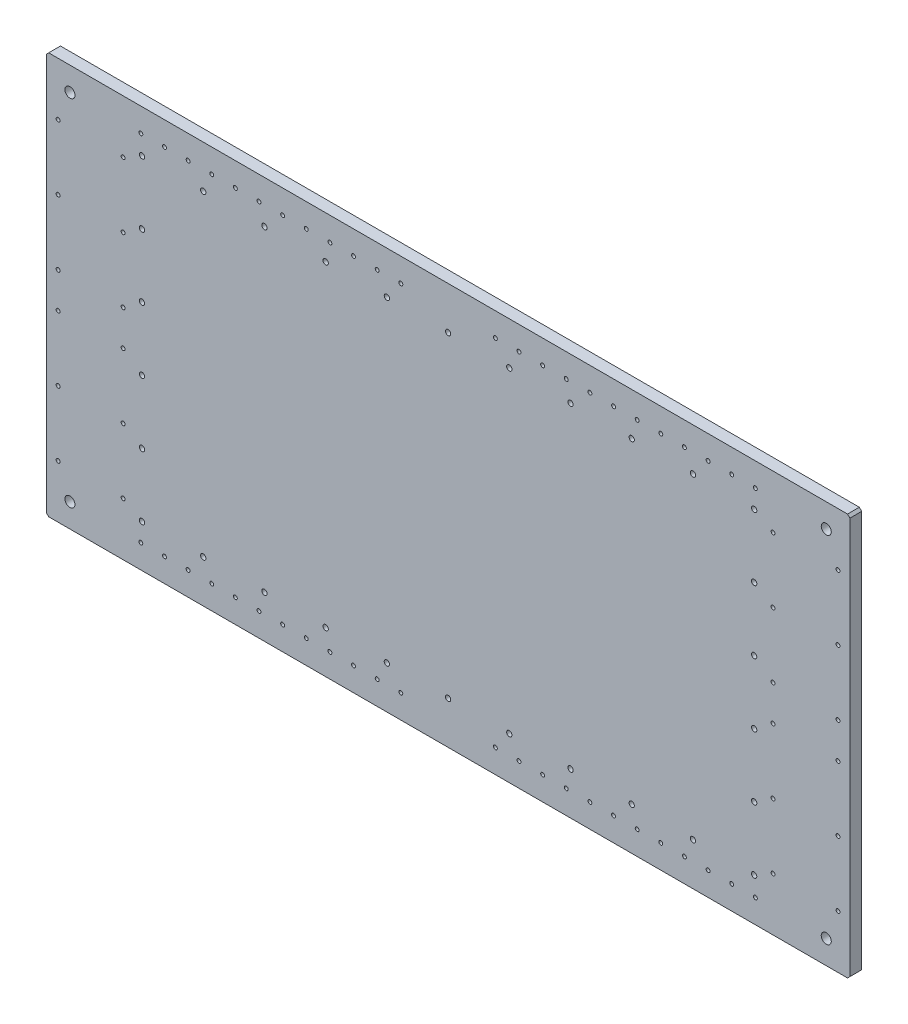
from build123d import *
from build123d.topology import SkipClean

# Parameters (mm, degrees)
SKETCH1_R              = 2.25
BOSS_EXTRUDE1_DEPTH    = 10
SKETCH2_W              = 10
SKETCH2_H              = 140
BOSS_EXTRUDE2_DEPTH    = 75
SKETCH3_W              = 340
SKETCH3_H              = 10
BOSS_EXTRUDE3_DEPTH    = 30
M10X1_5_TAPPED_HOLE1_D = 8.5
M4X0_7_TAPPED_HOLE1_D  = 3.3
LPATTERN1_COUNT        = 12
LPATTERN1_PITCH        = 20
M4X0_7_TAPPED_HOLE2_D  = 3.3
CHAMFER1_SIZE          = 2.5
MIRROR3_COPY_1_D       = 3.3
MIRROR3_COPY_2_D       = 3.3
MIRROR3_COPY_3_D       = 3.3
MIRROR3_COPY_4_D       = 3.3
MIRROR3_COPY_5_D       = 3.3
MIRROR3_COPY_6_D       = 3.3
MIRROR3_COPY_7_D       = 3.3
MIRROR3_COPY_8_D       = 3.3
MIRROR3_COPY_9_D       = 3.3
MIRROR3_COPY_10_D      = 3.3
MIRROR3_COPY_11_D      = 3.3
MIRROR4_COPY_1_D       = 8.5
MIRROR4_COPY_2_D       = 3.3
MIRROR4_COPY_3_D       = 3.3
MIRROR4_COPY_4_D       = 3.3
MIRROR4_COPY_5_D       = 3.3
MIRROR4_COPY_6_D       = 3.3
MIRROR4_COPY_7_D       = 3.3
MIRROR4_COPY_8_D       = 3.3
MIRROR4_COPY_9_D       = 3.3
MIRROR4_COPY_10_D      = 3.3
MIRROR4_COPY_11_D      = 3.3
MIRROR4_COPY_12_D      = 3.3
MIRROR4_COPY_13_D      = 3.3
MIRROR4_COPY_14_D      = 3.3
MIRROR4_COPY_15_D      = 8.5
MIRROR4_COPY_16_D      = 3.3
MIRROR4_COPY_17_D      = 3.3
CHAMFER2_SIZE          = 2


with BuildPart() as part:
    # Sketch1 → Boss-Extrude1 (new body)
    with BuildSketch(Plane.XY):
        with BuildLine():
            Line((265, 8.25), (265, 140))
            Line((265, 140), (0, 140))
            Line((0, 140), (0, 0))
            Line((0, 0), (265, 0))
            Line((265, 0), (265, 3.75))
            ThreePointArc((265, 3.75), (262.75, 6), (265, 8.25))
        make_face()
        with Locations((6, 113.2)):
            Circle(SKETCH1_R, mode=Mode.SUBTRACT)
        with Locations((6, 59.6)):
            Circle(SKETCH1_R, mode=Mode.SUBTRACT)
        with Locations((6, 6)):
            Circle(SKETCH1_R, mode=Mode.SUBTRACT)
        with Locations((57.8, 6)):
            Circle(SKETCH1_R, mode=Mode.SUBTRACT)
        with Locations((109.6, 6)):
            Circle(SKETCH1_R, mode=Mode.SUBTRACT)
        with Locations((161.4, 6)):
            Circle(SKETCH1_R, mode=Mode.SUBTRACT)
        with Locations((213.2, 6)):
            Circle(SKETCH1_R, mode=Mode.SUBTRACT)
    extrude(amount=BOSS_EXTRUDE1_DEPTH)

    # Sketch2 → Boss-Extrude2 (add)
    with BuildSketch(Plane.ZY):
        with Locations((5, 70)):
            Rectangle(SKETCH2_W, SKETCH2_H)
    extrude(amount=BOSS_EXTRUDE2_DEPTH)

    # Sketch3 → Boss-Extrude3 (add)
    with BuildSketch(Plane.XZ):
        with Locations((95, 5)):
            Rectangle(SKETCH3_W, SKETCH3_H)
    extrude(amount=BOSS_EXTRUDE3_DEPTH)

    # M10x1.5 Tapped Hole1 (through all)
    with Locations(Plane(origin=(-55, -10, 10), x_dir=(1, 0, 0), z_dir=(0, 0, 1))):
        with Locations((0, 0)):
            m10x1_5_tapped_hole1 = Hole(M10X1_5_TAPPED_HOLE1_D / 2)

    # M4x0.7 Tapped Hole1 (through all)
    with Locations(Plane(origin=(225, -10, 10), x_dir=(1, 0, 0), z_dir=(0, 0, 1))):
        with Locations((0, 0)):
            m4x0_7_tapped_hole1 = Hole(M4X0_7_TAPPED_HOLE1_D / 2)

    # LPattern1: M4x0.7 Tapped Hole1 ×12
    with Locations(*[(-i * LPATTERN1_PITCH, 0, 0) for i in range(1, LPATTERN1_COUNT)]):
        add(m4x0_7_tapped_hole1, mode=Mode.SUBTRACT)

    # M4x0.7 Tapped Hole2 (through all)
    with Locations(Plane(origin=(-10, 125, 10), x_dir=(1, 0, 0), z_dir=(0, 0, 1))):
        with Locations((0, 0), (0, -55), (0, -110), (-55, 0), (-55, -55), (-55, -110)):
            m4x0_7_tapped_hole2 = Hole(M4X0_7_TAPPED_HOLE2_D / 2)

    # Chamfer1
    chamfer1_edges = [part.edges().sort_by_distance(p)[0] for p in [
        (262.75, 6, 0),
        (210.95, 6, 0),
        (159.15, 6, 0),
        (107.35, 6, 0),
        (55.55, 6, 0),
        (3.75, 6, 0),
        (3.75, 59.6, 0),
        (3.75, 113.2, 0),
    ]]
    chamfer(chamfer1_edges, length=CHAMFER1_SIZE)

    # Mirror1: part across plane


with BuildPart() as part_1:
    with SkipClean():  # the faces are left unmerged after this step: merging them gives an invalid solid
        add(part.part)
        add(part.part.mirror(Plane(origin=(265, 8.25, 10), x_dir=(0, 0, 1), z_dir=(-1, 0, 0))))

    # Mirror2: part across plane


with BuildPart() as part_2:
    with SkipClean():  # the faces are left unmerged after this step: merging them gives an invalid solid
        add(part_1.part)
        add(part_1.part.mirror(Plane(origin=(0, 140, 10), x_dir=(0, 0, 1), z_dir=(0, 1, 0))))

    # Mirror3: M10x1.5 Tapped Hole1, M4x0.7 Tapped Hole1, M4x0.7 Tapped Hole2 across plane
    with SkipClean():  # the faces are left unmerged after this step: merging them gives an invalid solid
        add(m10x1_5_tapped_hole1.mirror(Plane(origin=(265, 0, 0), x_dir=(0, 0, 1), z_dir=(1, 0, 0))), mode=Mode.SUBTRACT)
        add(m4x0_7_tapped_hole1.mirror(Plane(origin=(265, 0, 0), x_dir=(0, 0, 1), z_dir=(1, 0, 0))), mode=Mode.SUBTRACT)
        add(m4x0_7_tapped_hole2.mirror(Plane(origin=(265, 0, 0), x_dir=(0, 0, 1), z_dir=(1, 0, 0))), mode=Mode.SUBTRACT)

    # Mirror3 copy 1 (through all)
    with Locations(Plane(origin=(325, -10, 10), x_dir=(-1, 0, 0), z_dir=(0, 0, 1))):
        with Locations((0, 0)):
            Hole(MIRROR3_COPY_1_D / 2)

    # Mirror3 copy 2 (through all)
    with Locations(Plane(origin=(345, -10, 10), x_dir=(-1, 0, 0), z_dir=(0, 0, 1))):
        with Locations((0, 0)):
            Hole(MIRROR3_COPY_2_D / 2)

    # Mirror3 copy 3 (through all)
    with Locations(Plane(origin=(365, -10, 10), x_dir=(-1, 0, 0), z_dir=(0, 0, 1))):
        with Locations((0, 0)):
            Hole(MIRROR3_COPY_3_D / 2)

    # Mirror3 copy 4 (through all)
    with Locations(Plane(origin=(385, -10, 10), x_dir=(-1, 0, 0), z_dir=(0, 0, 1))):
        with Locations((0, 0)):
            Hole(MIRROR3_COPY_4_D / 2)

    # Mirror3 copy 5 (through all)
    with Locations(Plane(origin=(405, -10, 10), x_dir=(-1, 0, 0), z_dir=(0, 0, 1))):
        with Locations((0, 0)):
            Hole(MIRROR3_COPY_5_D / 2)

    # Mirror3 copy 6 (through all)
    with Locations(Plane(origin=(425, -10, 10), x_dir=(-1, 0, 0), z_dir=(0, 0, 1))):
        with Locations((0, 0)):
            Hole(MIRROR3_COPY_6_D / 2)

    # Mirror3 copy 7 (through all)
    with Locations(Plane(origin=(445, -10, 10), x_dir=(-1, 0, 0), z_dir=(0, 0, 1))):
        with Locations((0, 0)):
            Hole(MIRROR3_COPY_7_D / 2)

    # Mirror3 copy 8 (through all)
    with Locations(Plane(origin=(465, -10, 10), x_dir=(-1, 0, 0), z_dir=(0, 0, 1))):
        with Locations((0, 0)):
            Hole(MIRROR3_COPY_8_D / 2)

    # Mirror3 copy 9 (through all)
    with Locations(Plane(origin=(485, -10, 10), x_dir=(-1, 0, 0), z_dir=(0, 0, 1))):
        with Locations((0, 0)):
            Hole(MIRROR3_COPY_9_D / 2)

    # Mirror3 copy 10 (through all)
    with Locations(Plane(origin=(505, -10, 10), x_dir=(-1, 0, 0), z_dir=(0, 0, 1))):
        with Locations((0, 0)):
            Hole(MIRROR3_COPY_10_D / 2)

    # Mirror3 copy 11 (through all)
    with Locations(Plane(origin=(525, -10, 10), x_dir=(-1, 0, 0), z_dir=(0, 0, 1))):
        with Locations((0, 0)):
            Hole(MIRROR3_COPY_11_D / 2)

    # Mirror4 copy 1 (through all)
    with Locations(Plane(origin=(585, 290, 10), x_dir=(-1, 0, 0), z_dir=(0, 0, 1))):
        with Locations((0, 0)):
            Hole(MIRROR4_COPY_1_D / 2)

    # Mirror4 copy 2 (through all)
    with Locations(Plane(origin=(305, 290, 10), x_dir=(-1, 0, 0), z_dir=(0, 0, 1))):
        with Locations((0, 0)):
            Hole(MIRROR4_COPY_2_D / 2)

    # Mirror4 copy 3 (through all)
    with Locations(Plane(origin=(540, 155, 10), x_dir=(-1, 0, 0), z_dir=(0, 0, 1))):
        with Locations((0, 0), (0, -55), (0, -110), (-55, 0), (-55, -55), (-55, -110)):
            Hole(MIRROR4_COPY_3_D / 2)

    # Mirror4 copy 4 (through all)
    with Locations(Plane(origin=(325, 290, 10), x_dir=(-1, 0, 0), z_dir=(0, 0, 1))):
        with Locations((0, 0)):
            Hole(MIRROR4_COPY_4_D / 2)

    # Mirror4 copy 5 (through all)
    with Locations(Plane(origin=(345, 290, 10), x_dir=(-1, 0, 0), z_dir=(0, 0, 1))):
        with Locations((0, 0)):
            Hole(MIRROR4_COPY_5_D / 2)

    # Mirror4 copy 6 (through all)
    with Locations(Plane(origin=(365, 290, 10), x_dir=(-1, 0, 0), z_dir=(0, 0, 1))):
        with Locations((0, 0)):
            Hole(MIRROR4_COPY_6_D / 2)

    # Mirror4 copy 7 (through all)
    with Locations(Plane(origin=(385, 290, 10), x_dir=(-1, 0, 0), z_dir=(0, 0, 1))):
        with Locations((0, 0)):
            Hole(MIRROR4_COPY_7_D / 2)

    # Mirror4 copy 8 (through all)
    with Locations(Plane(origin=(405, 290, 10), x_dir=(-1, 0, 0), z_dir=(0, 0, 1))):
        with Locations((0, 0)):
            Hole(MIRROR4_COPY_8_D / 2)

    # Mirror4 copy 9 (through all)
    with Locations(Plane(origin=(425, 290, 10), x_dir=(-1, 0, 0), z_dir=(0, 0, 1))):
        with Locations((0, 0)):
            Hole(MIRROR4_COPY_9_D / 2)

    # Mirror4 copy 10 (through all)
    with Locations(Plane(origin=(445, 290, 10), x_dir=(-1, 0, 0), z_dir=(0, 0, 1))):
        with Locations((0, 0)):
            Hole(MIRROR4_COPY_10_D / 2)

    # Mirror4 copy 11 (through all)
    with Locations(Plane(origin=(465, 290, 10), x_dir=(-1, 0, 0), z_dir=(0, 0, 1))):
        with Locations((0, 0)):
            Hole(MIRROR4_COPY_11_D / 2)

    # Mirror4 copy 12 (through all)
    with Locations(Plane(origin=(485, 290, 10), x_dir=(-1, 0, 0), z_dir=(0, 0, 1))):
        with Locations((0, 0)):
            Hole(MIRROR4_COPY_12_D / 2)

    # Mirror4 copy 13 (through all)
    with Locations(Plane(origin=(505, 290, 10), x_dir=(-1, 0, 0), z_dir=(0, 0, 1))):
        with Locations((0, 0)):
            Hole(MIRROR4_COPY_13_D / 2)

    # Mirror4 copy 14 (through all)
    with Locations(Plane(origin=(525, 290, 10), x_dir=(-1, 0, 0), z_dir=(0, 0, 1))):
        with Locations((0, 0)):
            Hole(MIRROR4_COPY_14_D / 2)

    # Mirror4 copy 15 (through all)
    with Locations(Plane(origin=(-55, 290, 10), x_dir=(1, 0, 0), z_dir=(0, 0, 1))):
        with Locations((0, 0)):
            Hole(MIRROR4_COPY_15_D / 2)

    # Mirror4 copy 16 (through all)
    with Locations(Plane(origin=(225, 290, 10), x_dir=(1, 0, 0), z_dir=(0, 0, 1))):
        with Locations((0, 0)):
            Hole(MIRROR4_COPY_16_D / 2)

    # Mirror4 copy 17 (through all)
    with Locations(Plane(origin=(-10, 155, 10), x_dir=(1, 0, 0), z_dir=(0, 0, 1))):
        with Locations((0, 0), (0, 55), (0, 110), (-55, 0), (-55, 55), (-55, 110)):
            Hole(MIRROR4_COPY_17_D / 2)

    # Chamfer2
    chamfer2_edges = [part_2.edges().sort_by_distance(p)[0] for p in [
        (-75, -30, 5),
        (-75, 310, 5),
        (605, 310, 5),
        (605, -30, 5),
    ]]
    chamfer(chamfer2_edges, length=CHAMFER2_SIZE)


solid = part_2.part
